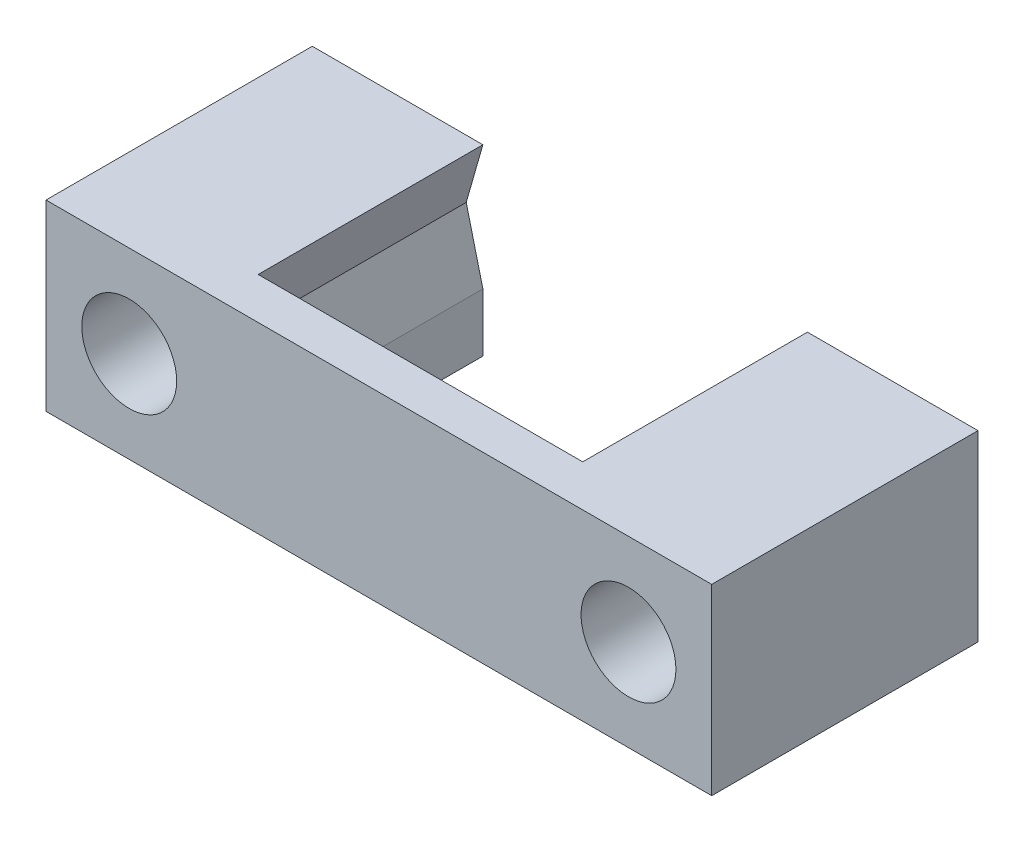
from build123d import *

# Parameters (mm, degrees)
SKETCH_1_W          = 40
SKETCH_1_H          = 11
SKETCH_1_R          = 1.6
EXTRUDE_1_DEPTH     = 14
CUT_EXTRUDE_1_DEPTH = 11.5
SKETCH_3_R          = 2.85
CUT_EXTRUDE_2_DEPTH = 5
EXTRUDE_START       = 2
SKETCH_4_R          = 1.6
EXTRUDE_2_DEPTH     = 2


with BuildPart() as part:
    # 草图1 → 凸台-拉伸1 (new body)
    with BuildSketch(Plane.XY):
        with Locations((20, 5.5)):
            Rectangle(SKETCH_1_W, SKETCH_1_H)
        with Locations((5, 5.5)):
            Circle(SKETCH_1_R, mode=Mode.SUBTRACT)
        with Locations((35, 5.5)):
            Circle(SKETCH_1_R, mode=Mode.SUBTRACT)
    extrude(amount=EXTRUDE_1_DEPTH)

    # 草图2 → 切除-拉伸1 (cut)
    with BuildSketch(Plane(origin=(0, 0, 0), x_dir=(-1, 0, 0), z_dir=(0, 0, -1))):
        Polygon((-29.75, 11), (-30.75, 7.5), (-29.75, 3.5), (-29.75, 0), (-10.25, 0), (-10.25, 3.5), (-9.25, 7.5), (-10.25, 11), align=None)
    extrude(amount=-CUT_EXTRUDE_1_DEPTH, mode=Mode.SUBTRACT)

    # 草图3 → 切除-拉伸2 (cut)
    with BuildSketch(Plane.XY.offset(14)):
        with Locations((5, 5.5)):
            Circle(SKETCH_3_R)
        with Locations((35, 5.5)):
            Circle(SKETCH_3_R)
    extrude(amount=-CUT_EXTRUDE_2_DEPTH, mode=Mode.SUBTRACT)

    # 草图4 → 凸台-拉伸2 (add)
    # profile 1 of 2: a face of its own
    with BuildSketch(Plane(origin=(0, 0, 0), x_dir=(-1, 0, 0), z_dir=(0, 0, -1)).offset(EXTRUDE_START)):
        Polygon((-10.25, 11), (-9.25, 7.5), (-10.25, 3.5), (-10.25, 0), (0, 0), (0, 11), align=None)
        with Locations((-5, 5.5)):
            Circle(SKETCH_4_R, mode=Mode.SUBTRACT)
    # profile 2 of 2: a face of its own
    with BuildSketch(Plane(origin=(0, 0, 0), x_dir=(-1, 0, 0), z_dir=(0, 0, -1)).offset(EXTRUDE_START)):
        Polygon((-29.75, 0), (-29.75, 3.5), (-30.75, 7.5), (-29.75, 11), (-40, 11), (-40, 0), align=None)
        with Locations((-35, 5.5)):
            Circle(SKETCH_4_R, mode=Mode.SUBTRACT)
    extrude(amount=-EXTRUDE_2_DEPTH)


solid = part.part
